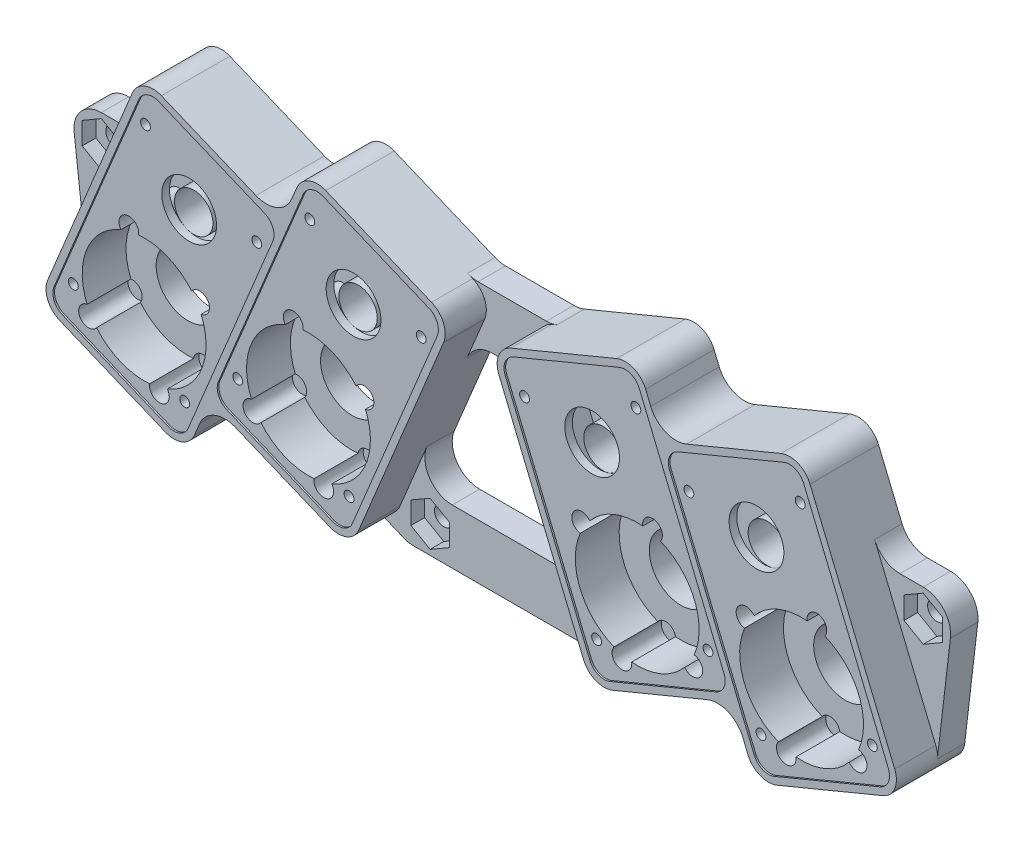
from build123d import *

# Parameters (mm, degrees)
SKETCH5_R             = 7.366
BOSS_EXTRUDE3_DEPTH   = 15.875
CAVITY1_START         = 5.334
CAVITY1_OUTLINE_R     = 1.143
CAVITY1_OUTLINE_R_2   = 4.445
CAVITY1_OUTLINE_R_3   = 7.366
CAVITY1_DEPTH         = 10.541
CAVITY1_START_2       = 15.494
CAVITY1_2_OUTLINE_R   = 1.143
CAVITY1_2_OUTLINE_R_2 = 4.445
CAVITY1_2_DEPTH       = 0.381
CAVITY1_START_3       = 2.286
CAVITY1_3_OUTLINE_R   = 1.143
CAVITY1_3_OUTLINE_R_2 = 4.445
CAVITY1_3_DEPTH       = 3.048
CAVITY1_4_OUTLINE_R   = 1.905
CAVITY1_4_DEPTH       = 3.302
CAVITY1_START_4       = 13.716
CAVITY1_5_OUTLINE_R   = 6.35
CAVITY1_5_OUTLINE_R_2 = 4.445
CAVITY1_5_DEPTH       = 1.778
CAVITY1_START_5       = 4.064
CAVITY1_6_OUTLINE_R   = 2.286
CAVITY1_6_DEPTH       = 1.27
CAVITY1_START_6       = 2.032
CAVITY1_7_DEPTH       = 0.254
SKETCH7_R             = 2.159
BOSS_EXTRUDE4_DEPTH   = 6.35
FILLET1_R             = 6.35
CUT_EXTRUDE2_DEPTH    = 3.175


# Read off the part's stored shape, not the designer's step: Cavity1
with BuildPart() as part:
    # Sketch5 → Boss-Extrude3 (new body)
    with BuildSketch(Plane.XY):
        with BuildLine():
            Line((-2.335801226, 42.481590997), (-21.970522774, -4.920820057))
            ThreePointArc((-21.970522774, -4.920820057), (-21.970522774, -8.857484526), (-19.186880633, -11.641126667))
            Line((-19.186880633, -11.641126667), (5.335653798, -21.798693012))
            ThreePointArc((5.335653798, -21.798693012), (9.272318267, -21.798693012), (12.055960408, -19.015050871))
            Line((12.055960408, -19.015050871), (15.667243992, -10.296641065))
            Line((15.667243992, -10.296641065), (43.435653798, -21.798693012))
            ThreePointArc((43.435653798, -21.798693012), (47.372318267, -21.798693012), (50.155960408, -19.015050871))
            Line((50.155960408, -19.015050871), (69.790681956, 28.387360183))
            ThreePointArc((69.790681956, 28.387360183), (69.790681956, 32.324024652), (67.007039815, 35.107666793))
            Line((67.007039815, 35.107666793), (42.484505384, 45.265233138))
            ThreePointArc((42.484505384, 45.265233138), (38.547840915, 45.265233138), (35.764198774, 42.481590997))
            Line((35.764198774, 42.481590997), (32.15291519, 33.763181191))
            Line((32.15291519, 33.763181191), (4.384505384, 45.265233138))
            ThreePointArc((4.384505384, 45.265233138), (0.447840915, 45.265233138), (-2.335801226, 42.481590997))
        make_face()
        Circle(SKETCH5_R, mode=Mode.SUBTRACT)
        with Locations((38.1, 0)):
            Circle(SKETCH5_R, mode=Mode.SUBTRACT)
    extrude(amount=BOSS_EXTRUDE3_DEPTH)

    # Cavity1 outline → Cavity1 (cut)
    # profile 1 of 12: a face of its own
    with BuildSketch(Plane.XY.offset(CAVITY1_START)):
        with Locations((47.507339764, -13.794041995)):
            Circle(CAVITY1_OUTLINE_R)
    # profile 2 of 12: a face of its own
    with BuildSketch(Plane.XY.offset(CAVITY1_START)):
        with Locations((21.694145625, -3.101866895)):
            Circle(CAVITY1_OUTLINE_R)
    # profile 3 of 12: a face of its own
    with BuildSketch(Plane.XY.offset(CAVITY1_START)):
        with Locations((38.412819418, 37.260582121)):
            Circle(CAVITY1_OUTLINE_R)
    # profile 4 of 12: a face of its own
    with BuildSketch(Plane.XY.offset(CAVITY1_START)):
        with Locations((64.226013557, 26.568407021)):
            Circle(CAVITY1_OUTLINE_R)
    # profile 5 of 12: a face of its own
    with BuildSketch(Plane.XY.offset(CAVITY1_START)):
        with Locations((47.820159182, 23.466540126)):
            Circle(CAVITY1_OUTLINE_R_2)
    # profile 6 of 12: a face of its own
    with BuildSketch(Plane.XY.offset(CAVITY1_START)):
        with BuildLine():
            ThreePointArc((51.313111346, 5.60043655), (52.930146901, 9.052970005), (49.120255142, 9.192669775))
            ThreePointArc((49.120255142, 9.192669775), (43.591889938, 13.258595171), (36.807701994, 14.292696277))
            ThreePointArc((36.807701994, 14.292696277), (34.014919039, 16.88791392), (32.717026028, 13.303187295))
            ThreePointArc((32.717026028, 13.303187295), (24.841404829, 5.491889937), (24.886888654, -5.60043655))
            ThreePointArc((24.886888654, -5.60043655), (23.269853099, -9.052970005), (27.079744858, -9.192669775))
            ThreePointArc((27.079744858, -9.192669775), (32.608110062, -13.258595171), (39.392298006, -14.292696277))
            ThreePointArc((39.392298006, -14.292696277), (42.185080961, -16.88791392), (43.482973972, -13.303187295))
            ThreePointArc((43.482973972, -13.303187295), (51.358595171, -5.491889937), (51.313111346, 5.60043655))
        make_face()
        with Locations((38.1, 0)):
            Circle(CAVITY1_OUTLINE_R_3, mode=Mode.SUBTRACT)
    # profile 7 of 12: a face of its own
    with BuildSketch(Plane.XY.offset(CAVITY1_START)):
        with Locations((9.407339764, -13.794041995)):
            Circle(CAVITY1_OUTLINE_R)
    # profile 8 of 12: a face of its own
    with BuildSketch(Plane.XY.offset(CAVITY1_START)):
        with Locations((-16.405854375, -3.101866895)):
            Circle(CAVITY1_OUTLINE_R)
    # profile 9 of 12: a face of its own
    with BuildSketch(Plane.XY.offset(CAVITY1_START)):
        with Locations((0.312819418, 37.260582121)):
            Circle(CAVITY1_OUTLINE_R)
    # profile 10 of 12: a face of its own
    with BuildSketch(Plane.XY.offset(CAVITY1_START)):
        with Locations((26.126013557, 26.568407021)):
            Circle(CAVITY1_OUTLINE_R)
    # profile 11 of 12: a face of its own
    with BuildSketch(Plane.XY.offset(CAVITY1_START)):
        with Locations((9.720159182, 23.466540126)):
            Circle(CAVITY1_OUTLINE_R_2)
    # profile 12 of 12: a face of its own
    with BuildSketch(Plane.XY.offset(CAVITY1_START)):
        with BuildLine():
            ThreePointArc((13.213111346, 5.60043655), (14.830146901, 9.052970005), (11.020255142, 9.192669775))
            ThreePointArc((11.020255142, 9.192669775), (5.491889938, 13.258595171), (-1.292298006, 14.292696277))
            ThreePointArc((-1.292298006, 14.292696277), (-4.085080961, 16.88791392), (-5.382973972, 13.303187295))
            ThreePointArc((-5.382973972, 13.303187295), (-13.258595171, 5.491889937), (-13.213111346, -5.60043655))
            ThreePointArc((-13.213111346, -5.60043655), (-14.830146901, -9.052970005), (-11.020255142, -9.192669775))
            ThreePointArc((-11.020255142, -9.192669775), (-5.491889938, -13.258595171), (1.292298006, -14.292696277))
            ThreePointArc((1.292298006, -14.292696277), (4.085080961, -16.88791392), (5.382973972, -13.303187295))
            ThreePointArc((5.382973972, -13.303187295), (13.258595171, -5.491889937), (13.213111346, 5.60043655))
        make_face()
        Circle(CAVITY1_OUTLINE_R_3, mode=Mode.SUBTRACT)
    extrude(amount=CAVITY1_DEPTH, mode=Mode.SUBTRACT)

    # Cavity1 2 outline → Cavity1 2 (cut)
    # profile 1 of 2: a face of its own
    with BuildSketch(Plane.XY.offset(CAVITY1_START_2)):
        with BuildLine():
            ThreePointArc((44.043163747, -20.332034254), (46.764808318, -20.332034254), (48.68930165, -18.407540922))
            Line((48.68930165, -18.407540922), (68.324023198, 28.994870132))
            ThreePointArc((68.324023198, 28.994870132), (68.324023198, 31.716514703), (66.399529866, 33.641008035))
            Line((66.399529866, 33.641008035), (41.876995435, 43.79857438))
            ThreePointArc((41.876995435, 43.79857438), (39.155350864, 43.79857438), (37.230857532, 41.874081048))
            Line((37.230857532, 41.874081048), (17.596135984, -5.528330006))
            ThreePointArc((17.596135984, -5.528330006), (17.596135984, -8.249974577), (19.520629316, -10.174467909))
            Line((19.520629316, -10.174467909), (44.043163747, -20.332034254))
        make_face()
        with Locations((64.226013557, 26.568407021)):
            Circle(CAVITY1_2_OUTLINE_R, mode=Mode.SUBTRACT)
        with BuildLine():
            ThreePointArc((49.120255142, 9.192669775), (52.930146901, 9.052970005), (51.313111346, 5.60043655))
            ThreePointArc((51.313111346, 5.60043655), (51.358595171, -5.491889937), (43.482973972, -13.303187295))
            ThreePointArc((43.482973972, -13.303187295), (42.185080961, -16.88791392), (39.392298006, -14.292696277))
            ThreePointArc((39.392298006, -14.292696277), (32.608110062, -13.258595171), (27.079744858, -9.192669775))
            ThreePointArc((27.079744858, -9.192669775), (23.269853099, -9.052970005), (24.886888654, -5.60043655))
            ThreePointArc((24.886888654, -5.60043655), (24.841404829, 5.491889937), (32.717026028, 13.303187295))
            ThreePointArc((32.717026028, 13.303187295), (34.014919039, 16.88791392), (36.807701994, 14.292696277))
            ThreePointArc((36.807701994, 14.292696277), (43.591889938, 13.258595171), (49.120255142, 9.192669775))
        make_face(mode=Mode.SUBTRACT)
        with Locations((21.694145625, -3.101866895)):
            Circle(CAVITY1_2_OUTLINE_R, mode=Mode.SUBTRACT)
        with Locations((47.507339764, -13.794041995)):
            Circle(CAVITY1_2_OUTLINE_R, mode=Mode.SUBTRACT)
        with Locations((47.820159182, 23.466540126)):
            Circle(CAVITY1_2_OUTLINE_R_2, mode=Mode.SUBTRACT)
        with Locations((38.412819418, 37.260582121)):
            Circle(CAVITY1_2_OUTLINE_R, mode=Mode.SUBTRACT)
    # profile 2 of 2: a face of its own
    with BuildSketch(Plane.XY.offset(CAVITY1_START_2)):
        with BuildLine():
            ThreePointArc((5.943163747, -20.332034254), (8.664808318, -20.332034254), (10.58930165, -18.407540922))
            Line((10.58930165, -18.407540922), (30.224023198, 28.994870132))
            ThreePointArc((30.224023198, 28.994870132), (30.224023198, 31.716514703), (28.299529866, 33.641008035))
            Line((28.299529866, 33.641008035), (3.776995435, 43.79857438))
            ThreePointArc((3.776995435, 43.79857438), (1.055350864, 43.79857438), (-0.869142468, 41.874081048))
            Line((-0.869142468, 41.874081048), (-20.503864016, -5.528330006))
            ThreePointArc((-20.503864016, -5.528330006), (-20.503864016, -8.249974577), (-18.579370684, -10.174467909))
            Line((-18.579370684, -10.174467909), (5.943163747, -20.332034254))
        make_face()
        with Locations((26.126013557, 26.568407021)):
            Circle(CAVITY1_2_OUTLINE_R, mode=Mode.SUBTRACT)
        with BuildLine():
            ThreePointArc((11.020255142, 9.192669775), (14.830146901, 9.052970005), (13.213111346, 5.60043655))
            ThreePointArc((13.213111346, 5.60043655), (13.258595171, -5.491889937), (5.382973972, -13.303187295))
            ThreePointArc((5.382973972, -13.303187295), (4.085080961, -16.88791392), (1.292298006, -14.292696277))
            ThreePointArc((1.292298006, -14.292696277), (-5.491889938, -13.258595171), (-11.020255142, -9.192669775))
            ThreePointArc((-11.020255142, -9.192669775), (-14.830146901, -9.052970005), (-13.213111346, -5.60043655))
            ThreePointArc((-13.213111346, -5.60043655), (-13.258595171, 5.491889937), (-5.382973972, 13.303187295))
            ThreePointArc((-5.382973972, 13.303187295), (-4.085080961, 16.88791392), (-1.292298006, 14.292696277))
            ThreePointArc((-1.292298006, 14.292696277), (5.491889938, 13.258595171), (11.020255142, 9.192669775))
        make_face(mode=Mode.SUBTRACT)
        with Locations((9.407339764, -13.794041995)):
            Circle(CAVITY1_2_OUTLINE_R, mode=Mode.SUBTRACT)
        with Locations((-16.405854375, -3.101866895)):
            Circle(CAVITY1_2_OUTLINE_R, mode=Mode.SUBTRACT)
        with Locations((9.720159182, 23.466540126)):
            Circle(CAVITY1_2_OUTLINE_R_2, mode=Mode.SUBTRACT)
        with Locations((0.312819418, 37.260582121)):
            Circle(CAVITY1_2_OUTLINE_R, mode=Mode.SUBTRACT)
    extrude(amount=CAVITY1_2_DEPTH, mode=Mode.SUBTRACT)

    # Cavity1 3 outline → Cavity1 3 (cut)
    with BuildSketch(Plane.XY.offset(CAVITY1_START_3)):
        with Locations((47.507339764, -13.794041995)):
            Circle(CAVITY1_3_OUTLINE_R)
        with Locations((21.694145625, -3.101866895)):
            Circle(CAVITY1_3_OUTLINE_R)
        with Locations((38.412819418, 37.260582121)):
            Circle(CAVITY1_3_OUTLINE_R)
        with Locations((64.226013557, 26.568407021)):
            Circle(CAVITY1_3_OUTLINE_R)
        with Locations((47.820159182, 23.466540126)):
            Circle(CAVITY1_3_OUTLINE_R_2)
        with BuildLine():
            ThreePointArc((40.069405609, 14.21522573), (41.502055713, 8.213289044), (46.759102448, 11.444262571))
            ThreePointArc((46.759102448, 11.444262571), (43.591889938, 13.258595171), (40.069405609, 14.21522573))
        make_face()
        with Locations((9.407339764, -13.794041995)):
            Circle(CAVITY1_3_OUTLINE_R)
        with Locations((-16.405854375, -3.101866895)):
            Circle(CAVITY1_3_OUTLINE_R)
        with Locations((0.312819418, 37.260582121)):
            Circle(CAVITY1_3_OUTLINE_R)
        with Locations((26.126013557, 26.568407021)):
            Circle(CAVITY1_3_OUTLINE_R)
        with Locations((9.720159182, 23.466540126)):
            Circle(CAVITY1_3_OUTLINE_R_2)
        with BuildLine():
            ThreePointArc((1.969405609, 14.21522573), (3.402055713, 8.213289044), (8.659102448, 11.444262571))
            ThreePointArc((8.659102448, 11.444262571), (5.491889938, 13.258595171), (1.969405609, 14.21522573))
        make_face()
    extrude(amount=CAVITY1_3_DEPTH, mode=Mode.SUBTRACT)

    # Cavity1 4 outline → Cavity1 4 (cut)
    with BuildSketch(Plane.XY):
        with Locations((64.226013557, 26.568407021)):
            Circle(CAVITY1_4_OUTLINE_R)
        with Locations((38.412819418, 37.260582121)):
            Circle(CAVITY1_4_OUTLINE_R)
        with Locations((21.694145625, -3.101866895)):
            Circle(CAVITY1_4_OUTLINE_R)
        with Locations((47.507339764, -13.794041995)):
            Circle(CAVITY1_4_OUTLINE_R)
        with Locations((26.126013557, 26.568407021)):
            Circle(CAVITY1_4_OUTLINE_R)
        with Locations((0.312819418, 37.260582121)):
            Circle(CAVITY1_4_OUTLINE_R)
        with Locations((-16.405854375, -3.101866895)):
            Circle(CAVITY1_4_OUTLINE_R)
        with Locations((9.407339764, -13.794041995)):
            Circle(CAVITY1_4_OUTLINE_R)
    extrude(amount=CAVITY1_4_DEPTH, mode=Mode.SUBTRACT)

    # Cavity1 5 outline → Cavity1 5 (cut)
    # profile 1 of 2: a face of its own
    with BuildSketch(Plane.XY.offset(CAVITY1_START_4)):
        with Locations((48.549171121, 25.226530635)):
            Circle(CAVITY1_5_OUTLINE_R)
        with Locations((47.820159182, 23.466540126)):
            Circle(CAVITY1_5_OUTLINE_R_2, mode=Mode.SUBTRACT)
    # profile 2 of 2: a face of its own
    with BuildSketch(Plane.XY.offset(CAVITY1_START_4)):
        with Locations((10.449171121, 25.226530635)):
            Circle(CAVITY1_5_OUTLINE_R)
        with Locations((9.720159182, 23.466540126)):
            Circle(CAVITY1_5_OUTLINE_R_2, mode=Mode.SUBTRACT)
    extrude(amount=CAVITY1_5_DEPTH, mode=Mode.SUBTRACT)

    # Cavity1 6 outline → Cavity1 6 (cut)
    with BuildSketch(Plane.XY.offset(CAVITY1_START_5)):
        with Locations((50.978965451, 7.861883547)):
            Circle(CAVITY1_6_OUTLINE_R)
        with Locations((41.647612637, -14.665994974)):
            Circle(CAVITY1_6_OUTLINE_R)
        with Locations((34.552387363, 14.665994974)):
            Circle(CAVITY1_6_OUTLINE_R)
        with Locations((25.221034549, -7.861883547)):
            Circle(CAVITY1_6_OUTLINE_R)
        with Locations((12.878965451, 7.861883547)):
            Circle(CAVITY1_6_OUTLINE_R)
        with Locations((3.547612637, -14.665994974)):
            Circle(CAVITY1_6_OUTLINE_R)
        with Locations((-3.547612637, 14.665994974)):
            Circle(CAVITY1_6_OUTLINE_R)
        with Locations((-12.878965451, -7.861883547)):
            Circle(CAVITY1_6_OUTLINE_R)
    extrude(amount=CAVITY1_6_DEPTH, mode=Mode.SUBTRACT)

    # Cavity1 7 outline → Cavity1 7 (cut)
    with BuildSketch(Plane.XY.offset(CAVITY1_START_6)):
        with BuildLine():
            ThreePointArc((40.069405609, 14.21522573), (41.502055713, 8.213289044), (46.759102448, 11.444262571))
            ThreePointArc((46.759102448, 11.444262571), (43.591889938, 13.258595171), (40.069405609, 14.21522573))
        make_face()
        with BuildLine():
            ThreePointArc((1.969405609, 14.21522573), (3.402055713, 8.213289044), (8.659102448, 11.444262571))
            ThreePointArc((8.659102448, 11.444262571), (5.491889938, 13.258595171), (1.969405609, 14.21522573))
        make_face()
    extrude(amount=CAVITY1_7_DEPTH, mode=Mode.SUBTRACT)

    # Sketch7 → Boss-Extrude4 (add)
    # profile 1 of 3: a face of its own
    with BuildSketch(Plane(origin=(0, 0, 0), x_dir=(-1, 0, 0), z_dir=(0, 0, -1))):
        with BuildLine():
            Line((-76.2, 35.107666793), (-67.007039815, 35.107666793))
            ThreePointArc((-67.007039815, 35.107666793), (-69.790681956, 32.324024652), (-69.790681956, 28.387360183))
            Line((-69.790681956, 28.387360183), (-67.313811855, 22.407666793))
            Line((-67.313811855, 22.407666793), (-76.2, 22.407666793))
            Line((-76.2, 22.407666793), (-76.2, 35.107666793))
        make_face()
    # profile 2 of 3: a face of its own
    with BuildSketch(Plane(origin=(0, 0, 0), x_dir=(-1, 0, 0), z_dir=(0, 0, -1))):
        with BuildLine():
            Line((-43.435653798, -21.798693012), (-52.129977971, -25.4))
            Line((-52.129977971, -25.4), (-76.2, -25.4))
            Line((-76.2, -25.4), (-76.2, -12.7))
            Line((-76.2, -12.7), (-52.771740126, -12.7))
            Line((-52.771740126, -12.7), (-50.155960408, -19.015050871))
            ThreePointArc((-50.155960408, -19.015050871), (-47.372318267, -21.798693012), (-43.435653798, -21.798693012))
        make_face()
        with Locations((-57.15, -19.05)):
            Circle(SKETCH7_R, mode=Mode.SUBTRACT)
    # profile 3 of 3: a face of its own
    with BuildSketch(Plane(origin=(0, 0, 0), x_dir=(-1, 0, 0), z_dir=(0, 0, -1))):
        with BuildLine():
            Line((19.05, 25.4), (9.411227884, 25.4))
            Line((9.411227884, 25.4), (21.970522774, -4.920820057))
            ThreePointArc((21.970522774, -4.920820057), (22.313221629, -6.182118398), (22.326942332, -7.489072012))
            Line((22.326942332, -7.489072012), (25.356659177, 18.309358369))
            ThreePointArc((25.356659177, 18.309358369), (23.794764186, 23.270155545), (19.05, 25.4))
        make_face()
        with Locations((19.05, 19.05)):
            Circle(SKETCH7_R, mode=Mode.SUBTRACT)
    extrude(amount=-BOSS_EXTRUDE4_DEPTH)

    # Fillet1
    fillet1_edges = [part.edges().sort_by_distance(p)[0] for p in [
        (32.15291519, 33.763181191, 7.9375),
        (15.667243992, -10.296641065, 7.9375),
        (67.007039815, 35.107666793, 3.175),
        (67.313811855, 22.407666793, 3.175),
        (52.129977971, -25.4, 3.175),
        (52.771740126, -12.7, 3.175),
        (-9.411227884, 25.4, 3.175),
    ]]
    fillet(fillet1_edges, radius=FILLET1_R)

    # Mirror1: part across plane


with BuildPart() as part_1:
    add(part.part)
    add(part.part.mirror(Plane(origin=(76.2, -25.4, 6.35), x_dir=(0, 0, 1), z_dir=(1, 0, 0))))

    # Sketch8 → Cut-Extrude2 (cut)
    with BuildSketch(Plane.XY.offset(6.35)):
        Polygon((-19.05, 24.182643893), (-23.495, 21.616321947), (-23.495, 16.483678053), (-19.05, 13.917356107), (-14.605, 16.483678053), (-14.605, 21.616321947), align=None)
        Polygon((57.15, -13.917356107), (52.705, -16.483678053), (52.705, -21.616321947), (57.15, -24.182643893), (61.595, -21.616321947), (61.595, -16.483678053), align=None)
        Polygon((90.805, -16.483678053), (95.25, -13.917356107), (99.695, -16.483678053), (99.695, -21.616321947), (95.25, -24.182643893), (90.805, -21.616321947), align=None)
        Polygon((167.005, 21.616321947), (171.45, 24.182643893), (175.895, 21.616321947), (175.895, 16.483678053), (171.45, 13.917356107), (167.005, 16.483678053), align=None)
    extrude(amount=-CUT_EXTRUDE2_DEPTH, mode=Mode.SUBTRACT)


solid = part_1.part
